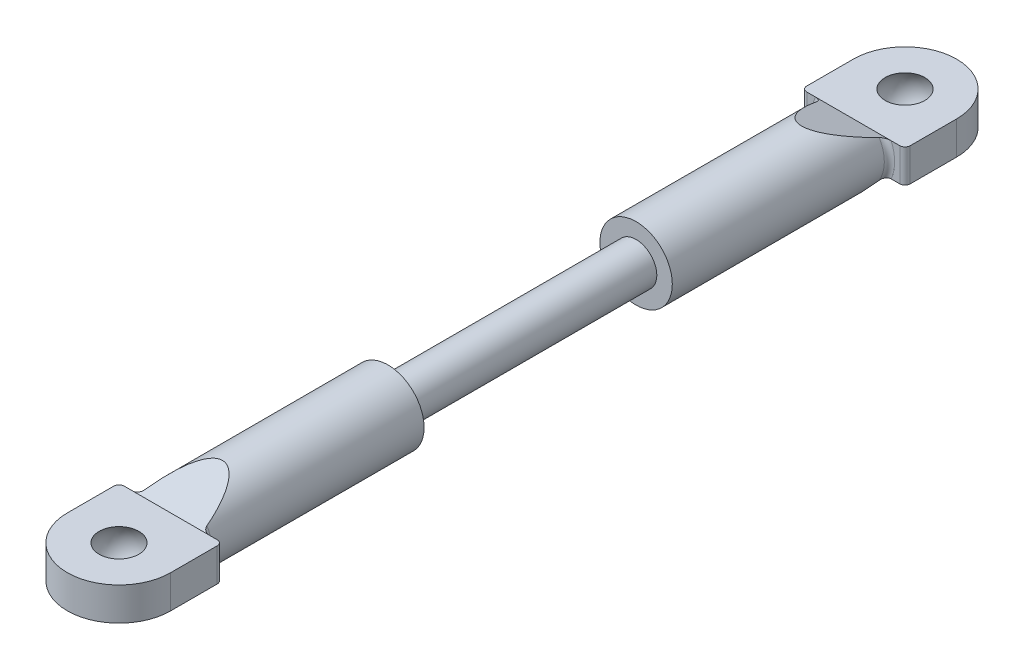
from build123d import *

# Parameters (mm, degrees)
SKETCH1_R                  = 2
SCREW_SECTION_DEPTH        = 12
SKETCH2_R                  = 3.5
BAR_SECTION_DEPTH          = 21
MOUNT_SECTION_DEPTH        = 1.6
BAR_TAPER_DEPTH            = 44.430979726
MOUNT_FILLET_R             = 0.5
MOUNT_FILLET_OF_MIRROR_2_R = 0.5


with BuildPart() as part:
    # Sketch1 → Screw Section (new body)
    with BuildSketch(Plane.XY):
        Circle(SKETCH1_R)
    screw_section = extrude(amount=SCREW_SECTION_DEPTH)

    # Sketch2 → Bar Section (add)
    with BuildSketch(Plane.XY.offset(12)):
        Circle(SKETCH2_R)
    bar_section = extrude(amount=BAR_SECTION_DEPTH)

    # Sketch3 → Mount Section (add, symmetric)
    with BuildSketch(Plane(origin=(0, 0, 0), x_dir=(1, 0, 0), z_dir=(0, 1, 0))):
        with BuildLine():
            Line((5, -33), (-5, -33))
            Line((-5, -33), (-5, -38))
            ThreePointArc((-5, -38), (0, -43), (5, -38))
            Line((5, -38), (5, -33))
        make_face()
    mount_section = extrude(amount=MOUNT_SECTION_DEPTH, both=True)

    # Sketch4 → Bar Taper (cut, symmetric)
    with BuildSketch(Plane(origin=(0, 0, 0), x_dir=(0, 0, -1), z_dir=(1, 0, 0))):
        Polygon((-28, -3.5), (-33, -1.6), (-33, -3.5), align=None)
        Polygon((-28, 3.5), (-33, 1.6), (-33, 3.5), align=None)
    bar_taper = extrude(amount=BAR_TAPER_DEPTH, both=True, mode=Mode.SUBTRACT)

    # Mount Fillet
    mount_fillet_edges = [part.edges().sort_by_distance(p)[0] for p in [
        (-5, 0, 33),
        (-3.5, 0, 33),
        (5, 0, 33),
        (3.401842713, -0.823083322, 33),
    ]]
    fillet(mount_fillet_edges, radius=MOUNT_FILLET_R)

    # Sketch6 → Ball Hole (revolve, cut)
    with BuildSketch(Plane(origin=(0, 0, 0), x_dir=(0, 0, -1), z_dir=(1, 0, 0))):
        with BuildLine():
            Line((-39.920937271, -1.6), (-38, -1.6))
            Line((-38, -1.6), (-38, 1.6))
            Line((-38, 1.6), (-39.920937271, 1.6))
            ThreePointArc((-39.920937271, 1.6), (-40.5, 0), (-39.920937271, -1.6))
        make_face()
    ball_hole = revolve(axis=Axis((0, -1.6, 38), (0, 1, 0)), mode=Mode.SUBTRACT)

    # Mirror 2: Screw Section, Bar Section, Mount Section, Bar Taper, Ball Hole across plane
    add(screw_section.mirror(Plane.XY))
    add(bar_section.mirror(Plane.XY))
    add(mount_section.mirror(Plane.XY))
    add(bar_taper.mirror(Plane.XY), mode=Mode.SUBTRACT)
    add(ball_hole.mirror(Plane.XY), mode=Mode.SUBTRACT)

    # Mount Fillet of Mirror 2
    mount_fillet_of_mirror_2_edges = [part.edges().sort_by_distance(p)[0] for p in [
        (-5, 0, -33),
        (-3.5, 0, -33),
        (5, 0, -33),
        (3.401842713, -0.823083322, -33),
    ]]
    fillet(mount_fillet_of_mirror_2_edges, radius=MOUNT_FILLET_OF_MIRROR_2_R)


solid = part.part
